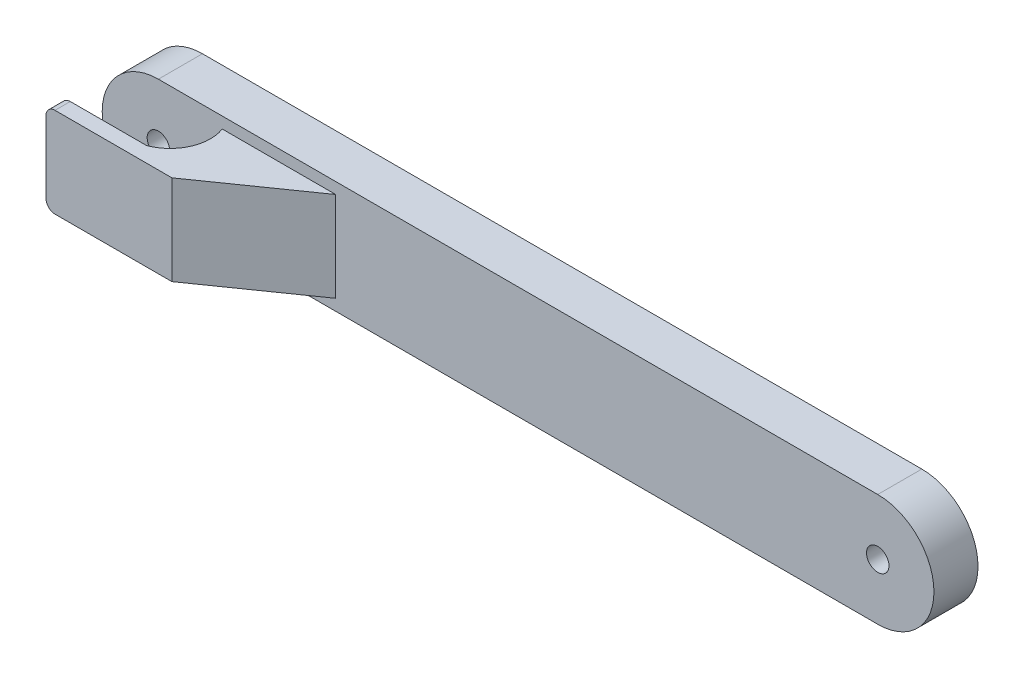
from build123d import *

# Parameters (mm, degrees)
SKETCH1_R           = 3.175
BOSS_EXTRUDE1_DEPTH = 12.446
BOSS_EXTRUDE8_DEPTH = 19.05
CUT_EXTRUDE3_DEPTH  = 41.148
BOSS_EXTRUDE9_DEPTH = 25.4


with BuildPart() as part:
    # Sketch1 → Boss-Extrude1 (new body)
    with BuildSketch(Plane.XY):
        with BuildLine():
            Line((299.870251741, -63.185614448), (503.070251741, -63.185614448))
            ThreePointArc((503.070251741, -63.185614448), (518.945251741, -79.060614448), (503.070251741, -94.935614448))
            Line((503.070251741, -94.935614448), (299.870251741, -94.935614448))
            ThreePointArc((299.870251741, -94.935614448), (283.995251741, -79.060614448), (299.870251741, -63.185614448))
        make_face()
        with Locations((299.870251741, -79.060614448)):
            Circle(SKETCH1_R, mode=Mode.SUBTRACT)
        with Locations((503.070251741, -79.060614448)):
            Circle(SKETCH1_R, mode=Mode.SUBTRACT)
    extrude(amount=BOSS_EXTRUDE1_DEPTH)

    # Sketch7 → Boss-Extrude8 (add)
    with BuildSketch(Plane.XY.offset(12.446)):
        with BuildLine():
            Line((310.030251741, -66.360614448), (312.570251741, -66.360614448))
            Line((312.570251741, -66.360614448), (322.730251741, -66.360614448))
            Line((322.730251741, -66.360614448), (322.730251741, -91.760614448))
            Line((322.730251741, -91.760614448), (310.030251741, -91.760614448))
            Line((310.030251741, -91.760614448), (289.710251741, -91.760614448))
            ThreePointArc((289.710251741, -91.760614448), (287.914200517, -91.016665672), (287.170251741, -89.220614448))
            Line((287.170251741, -89.220614448), (287.170251741, -68.900614448))
            ThreePointArc((287.170251741, -68.900614448), (287.914200517, -67.104563223), (289.710251741, -66.360614448))
            Line((289.710251741, -66.360614448), (310.030251741, -66.360614448))
        make_face()
    extrude(amount=BOSS_EXTRUDE8_DEPTH)

    # Sketch8 → Cut-Extrude3 (cut)
    with BuildSketch(Plane(origin=(0, -66.360614448, 0), x_dir=(1, 0, 0), z_dir=(0, 1, 0))):
        with BuildLine():
            Line((287.170251741, -12.446), (317.904251741, -12.446))
            ThreePointArc((317.904251741, -12.446), (317.648023156, -21.177345807), (311.300251741, -27.178))
            Line((311.300251741, -27.178), (287.170251741, -27.178))
            Line((287.170251741, -27.178), (287.170251741, -12.446))
        make_face()
    extrude(amount=-CUT_EXTRUDE3_DEPTH, mode=Mode.SUBTRACT)

    # Sketch9 → Boss-Extrude9 (add)
    with BuildSketch(Plane(origin=(0, -66.360614448, 0), x_dir=(1, 0, 0), z_dir=(0, 1, 0))):
        Polygon((322.730251741, -31.496), (349.936471269, -12.446), (322.730251741, -12.446), align=None)
    extrude(amount=-BOSS_EXTRUDE9_DEPTH)


solid = part.part
